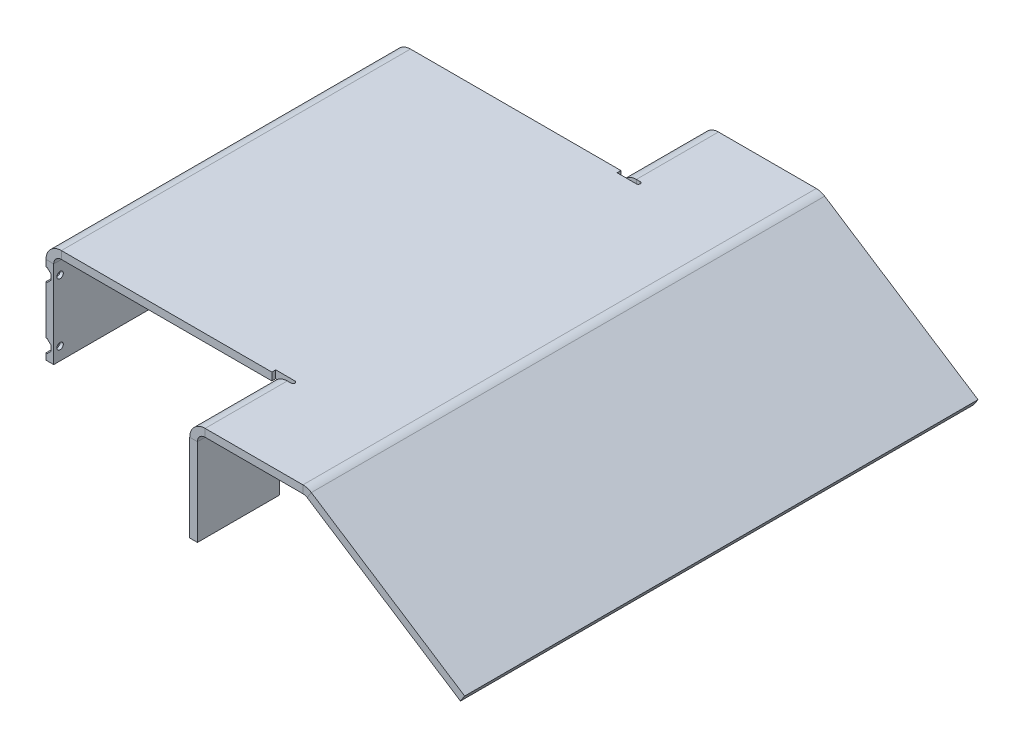
from build123d import *

# Parameters (mm, degrees)
SALIENTE_EXTRUIR1_DEPTH          = 3
BRIDA_DE_ARISTA1_STRIP_W         = 18
BRIDA_DE_ARISTA1_STRIP_H         = 3
BRIDA_DE_ARISTA1_STRIP_CUT_DEPTH = 136
BRIDA_DE_ARISTA1_DEPTH           = 136
CROQUIS5_R                       = 1.25
CORTAR_EXTRUIR1_DEPTH            = 3
CORTAR_EXTRUIR2_DEPTH            = 2
CHAFL_N1_SIZE                    = 1.5
BRIDA_START                      = -100
BRIDA_DE_ARISTA2_DEPTH           = 33.5
BRIDA_START_2                    = 66.5
BRIDA_DE_ARISTA2_2_DEPTH         = 33.5
BRIDA_DE_ARISTA2_3_DEPTH         = 32
BRIDA_START_3                    = 68
BRIDA_DE_ARISTA2_4_DEPTH         = 32
BRIDA_START_4                    = -3
BRIDA_DE_ARISTA2_5_DEPTH         = 7
BRIDA_DE_ARISTA3_STRIP_CUT_DEPTH = 200
BRIDA_DE_ARISTA3_DEPTH           = 200


with BuildPart() as part:
    # Croquis1 → Saliente-Extruir1 (new body)
    with BuildSketch(Plane(origin=(0, 0, 0), x_dir=(1, 0, 0), z_dir=(0, 1, 0))):
        Polygon((-42.5, -68), (42.5, -68), (42.5, -100), (87.5, -100), (87.5, 100), (42.5, 100), (42.5, 68), (-42.5, 68), align=None)
    extrude(amount=SALIENTE_EXTRUIR1_DEPTH)

    # Brida de arista1: sheet metal written as solids
    # Brida de arista1 strip (on a plane across the edge) → Brida de arista1 strip cut (cut)
    with BuildSketch(Plane(origin=(-42.5, 0, 68), x_dir=(1, 0, 0), z_dir=(0, 0, -1))):
        with Locations((-6, -1.5)):
            Rectangle(BRIDA_DE_ARISTA1_STRIP_W, BRIDA_DE_ARISTA1_STRIP_H)
    extrude(amount=BRIDA_DE_ARISTA1_STRIP_CUT_DEPTH, mode=Mode.SUBTRACT)

    # Brida de arista1 section (on a plane across the edge) → Brida de arista1 (add)
    with BuildSketch(Plane(origin=(-42.5, 0, 68), x_dir=(1, 0, 0), z_dir=(0, 0, -1))):
        with BuildLine():
            Line((-3, 3), (-3, 37))
            Line((-3, 37), (0, 37))
            Line((0, 37), (0, 3))
            ThreePointArc((0, 3), (0.878679656, 0.878679656), (3, 0))
            Line((3, 0), (3, -3))
            ThreePointArc((3, -3), (-1.242640687, -1.242640687), (-3, 3))
        make_face()
    extrude(amount=BRIDA_DE_ARISTA1_DEPTH)

    # Croquis5 → Cortar-Extruir1 (cut)
    with BuildSketch(Plane.ZY.offset(45.5)):
        with Locations(Location((65.5, -32, 0), (0, 0, 270))):
            Circle(CROQUIS5_R)
        with Locations(Location((65.5, -8, 0), (0, 0, 270))):
            Circle(CROQUIS5_R)
        with Locations(Location((-65.5, -8, 0), (0, 0, 90))):
            Circle(CROQUIS5_R)
        with Locations(Location((-65.5, -32, 0), (0, 0, 90))):
            Circle(CROQUIS5_R)
    extrude(amount=-CORTAR_EXTRUIR1_DEPTH, mode=Mode.SUBTRACT)

    # Croquis6 → Cortar-Extruir2 (cut)
    with BuildSketch(Plane.ZY.offset(45.5)):
        with BuildLine():
            Line((65.5, -5.5), (68, -5.5))
            Line((68, -5.5), (68, -10.5))
            Line((68, -10.5), (65.5, -10.5))
            ThreePointArc((65.5, -10.5), (63, -8), (65.5, -5.5))
        make_face()
        with BuildLine():
            Line((68, -29.5), (65.5, -29.5))
            ThreePointArc((65.5, -29.5), (63, -32), (65.5, -34.5))
            Line((65.5, -34.5), (68, -34.5))
            Line((68, -34.5), (68, -29.5))
        make_face()
        with BuildLine():
            Line((-65.5, -34.5), (-68, -34.5))
            Line((-68, -34.5), (-68, -29.5))
            Line((-68, -29.5), (-65.5, -29.5))
            ThreePointArc((-65.5, -29.5), (-63, -32), (-65.5, -34.5))
        make_face()
        with BuildLine():
            Line((-68, -10.5), (-65.5, -10.5))
            ThreePointArc((-65.5, -10.5), (-63, -8), (-65.5, -5.5))
            Line((-65.5, -5.5), (-68, -5.5))
            Line((-68, -5.5), (-68, -10.5))
        make_face()
    extrude(amount=-CORTAR_EXTRUIR2_DEPTH, mode=Mode.SUBTRACT)

    # Chaflán1
    # the kernel refuses this chamfer: 1.5 mm, written as the material it adds along each edge
    with BuildSketch(Plane(origin=(-43.5, -5.5, 65.5), x_dir=(-1, 0, 0), z_dir=(0, 0, 1))) as chafl_n1_piece_1_section:
        Polygon((CHAFL_N1_SIZE, 0), (0, CHAFL_N1_SIZE), (0, 0), align=None)
    chafl_n1_piece_1 = extrude(amount=2.5, mode=Mode.PRIVATE)
    chafl_n1_piece_1 = chafl_n1_piece_1 - Plane(origin=(-43.5, -8, 65.5), x_dir=(0, -1, 0), z_dir=(-1, 0, 0)) * Cylinder(1.25, 12, mode=Mode.PRIVATE)
    add(chafl_n1_piece_1)
    with BuildSketch(Plane(origin=(-43.5, -10.5, 68), x_dir=(0, 1, 0), z_dir=(0, 0, -1))) as chafl_n1_piece_2_section:
        Polygon((CHAFL_N1_SIZE, 0), (0, -CHAFL_N1_SIZE), (0, 0), align=None)
    chafl_n1_piece_2 = extrude(amount=2.5, mode=Mode.PRIVATE)
    chafl_n1_piece_2 = chafl_n1_piece_2 - Plane(origin=(-43.5, -8, 65.5), x_dir=(0, -1, 0), z_dir=(-1, 0, 0)) * Cylinder(1.25, 12, mode=Mode.PRIVATE)
    add(chafl_n1_piece_2)
    with BuildSketch(Plane(origin=(-43.5, -29.5, 68), x_dir=(-1, 0, 0), z_dir=(0, 0, -1))) as chafl_n1_piece_3_section:
        Polygon((CHAFL_N1_SIZE, 0), (0, -CHAFL_N1_SIZE), (0, 0), align=None)
    chafl_n1_piece_3 = extrude(amount=2.5, mode=Mode.PRIVATE)
    chafl_n1_piece_3 = chafl_n1_piece_3 - Plane(origin=(-43.5, -32, 65.5), x_dir=(0, -1, 0), z_dir=(-1, 0, 0)) * Cylinder(1.25, 12, mode=Mode.PRIVATE)
    add(chafl_n1_piece_3)
    with BuildSketch(Plane(origin=(-43.5, -34.5, 65.5), x_dir=(0, 1, 0), z_dir=(0, 0, 1))) as chafl_n1_piece_4_section:
        Polygon((CHAFL_N1_SIZE, 0), (0, CHAFL_N1_SIZE), (0, 0), align=None)
    chafl_n1_piece_4 = extrude(amount=2.5, mode=Mode.PRIVATE)
    chafl_n1_piece_4 = chafl_n1_piece_4 - Plane(origin=(-43.5, -32, 65.5), x_dir=(0, -1, 0), z_dir=(-1, 0, 0)) * Cylinder(1.25, 12, mode=Mode.PRIVATE)
    add(chafl_n1_piece_4)
    with BuildSketch(Plane(origin=(-43.5, -34.5, -65.5), x_dir=(-1, 0, 0), z_dir=(0, 0, -1))) as chafl_n1_piece_5_section:
        Polygon((CHAFL_N1_SIZE, 0), (0, CHAFL_N1_SIZE), (0, 0), align=None)
    chafl_n1_piece_5 = extrude(amount=2.5, mode=Mode.PRIVATE)
    chafl_n1_piece_5 = chafl_n1_piece_5 - Plane(origin=(-43.5, -32, -65.5), x_dir=(0, 1, 0), z_dir=(-1, 0, 0)) * Cylinder(1.25, 12, mode=Mode.PRIVATE)
    add(chafl_n1_piece_5)
    with BuildSketch(Plane(origin=(-43.5, -29.5, -68), x_dir=(-1, 0, 0), z_dir=(0, 0, 1))) as chafl_n1_piece_6_section:
        Polygon((CHAFL_N1_SIZE, 0), (0, CHAFL_N1_SIZE), (0, 0), align=None)
    chafl_n1_piece_6 = extrude(amount=2.5, mode=Mode.PRIVATE)
    chafl_n1_piece_6 = chafl_n1_piece_6 - Plane(origin=(-43.5, -32, -65.5), x_dir=(0, 1, 0), z_dir=(-1, 0, 0)) * Cylinder(1.25, 12, mode=Mode.PRIVATE)
    add(chafl_n1_piece_6)
    with BuildSketch(Plane(origin=(-43.5, -10.5, -68), x_dir=(-1, 0, 0), z_dir=(0, 0, 1))) as chafl_n1_piece_7_section:
        Polygon((CHAFL_N1_SIZE, 0), (0, -CHAFL_N1_SIZE), (0, 0), align=None)
    chafl_n1_piece_7 = extrude(amount=2.5, mode=Mode.PRIVATE)
    chafl_n1_piece_7 = chafl_n1_piece_7 - Plane(origin=(-43.5, -8, -65.5), x_dir=(0, 1, 0), z_dir=(-1, 0, 0)) * Cylinder(1.25, 12, mode=Mode.PRIVATE)
    add(chafl_n1_piece_7)
    with BuildSketch(Plane(origin=(-43.5, -5.5, -65.5), x_dir=(-1, 0, 0), z_dir=(0, 0, -1))) as chafl_n1_piece_8_section:
        Polygon((CHAFL_N1_SIZE, 0), (0, -CHAFL_N1_SIZE), (0, 0), align=None)
    chafl_n1_piece_8 = extrude(amount=2.5, mode=Mode.PRIVATE)
    chafl_n1_piece_8 = chafl_n1_piece_8 - Plane(origin=(-43.5, -8, -65.5), x_dir=(0, 1, 0), z_dir=(-1, 0, 0)) * Cylinder(1.25, 12, mode=Mode.PRIVATE)
    add(chafl_n1_piece_8)
    with BuildSketch(Plane(origin=(-43.5, -8, -65.5), x_dir=(0, -1, 0), z_dir=(0, 0, -1))) as chafl_n1_piece_9_section:
        Polygon((2.5, CHAFL_N1_SIZE), (2.5 - CHAFL_N1_SIZE, 0), (2.5, 0), align=None)
    chafl_n1_piece_9 = revolve(axis=Axis((-43.5, -8, -65.5), (-1, 0, 0)), revolution_arc=180, mode=Mode.PRIVATE)
    chafl_n1_piece_9 = chafl_n1_piece_9 - Plane(origin=(-43.5, -8, -65.5), x_dir=(0, 1, 0), z_dir=(-1, 0, 0)) * Cylinder(1.25, 11, mode=Mode.PRIVATE)
    add(chafl_n1_piece_9)
    with BuildSketch(Plane(origin=(-43.5, -32, -65.5), x_dir=(0, 1, 0), z_dir=(0, 0, -1))) as chafl_n1_piece_10_section:
        Polygon((2.5, -CHAFL_N1_SIZE), (2.5 - CHAFL_N1_SIZE, 0), (2.5, 0), align=None)
    chafl_n1_piece_10 = revolve(axis=Axis((-43.5, -32, -65.5), (1, 0, 0)), revolution_arc=180, mode=Mode.PRIVATE)
    chafl_n1_piece_10 = chafl_n1_piece_10 - Plane(origin=(-43.5, -32, -65.5), x_dir=(0, 1, 0), z_dir=(-1, 0, 0)) * Cylinder(1.25, 11, mode=Mode.PRIVATE)
    add(chafl_n1_piece_10)
    with BuildSketch(Plane(origin=(-43.5, -32, 65.5), x_dir=(0, 1, 0), z_dir=(0, 0, 1))) as chafl_n1_piece_11_section:
        Polygon((2.5 - CHAFL_N1_SIZE, 0), (2.5, CHAFL_N1_SIZE), (2.5, 0), align=None)
    chafl_n1_piece_11 = revolve(axis=Axis((-43.5, -32, 65.5), (-1, 0, 0)), revolution_arc=180, mode=Mode.PRIVATE)
    chafl_n1_piece_11 = chafl_n1_piece_11 - Plane(origin=(-43.5, -32, 65.5), x_dir=(0, -1, 0), z_dir=(-1, 0, 0)) * Cylinder(1.25, 11, mode=Mode.PRIVATE)
    add(chafl_n1_piece_11)
    with BuildSketch(Plane(origin=(-43.5, -8, 65.5), x_dir=(0, -1, 0), z_dir=(0, 0, 1))) as chafl_n1_piece_12_section:
        Polygon((2.5 - CHAFL_N1_SIZE, 0), (2.5, -CHAFL_N1_SIZE), (2.5, 0), align=None)
    chafl_n1_piece_12 = revolve(axis=Axis((-43.5, -8, 65.5), (1, 0, 0)), revolution_arc=180, mode=Mode.PRIVATE)
    chafl_n1_piece_12 = chafl_n1_piece_12 - Plane(origin=(-43.5, -8, 65.5), x_dir=(0, -1, 0), z_dir=(-1, 0, 0)) * Cylinder(1.25, 11, mode=Mode.PRIVATE)
    add(chafl_n1_piece_12)

    # Brida de arista2: read off the stored shape, not the designer's step
    # Brida de arista2 outline → Brida de arista2 (cut)
    with BuildSketch(Plane.XY.offset(BRIDA_START)):
        with BuildLine():
            Line((42.5, 0), (43.303847577, 0))
            ThreePointArc((43.303847577, 0), (45.5, 2.196152423), (48.5, 3))
            Line((48.5, 3), (42.5, 3))
            Line((42.5, 3), (42.5, 0))
        make_face()
    extrude(amount=BRIDA_DE_ARISTA2_DEPTH, mode=Mode.SUBTRACT)

    # Brida de arista2 2 outline → Brida de arista2 2 (cut)
    with BuildSketch(Plane.XY.offset(BRIDA_START_2)):
        with BuildLine():
            Line((42.5, 0), (43.303847577, 0))
            ThreePointArc((43.303847577, 0), (45.5, 2.196152423), (48.5, 3))
            Line((48.5, 3), (42.5, 3))
            Line((42.5, 3), (42.5, 0))
        make_face()
    extrude(amount=BRIDA_DE_ARISTA2_2_DEPTH, mode=Mode.SUBTRACT)

    # Brida de arista2 3 outline → Brida de arista2 3 (add)
    with BuildSketch(Plane.XY.offset(BRIDA_START)):
        with BuildLine():
            Line((42.5, -37), (45.5, -37))
            Line((45.5, -37), (45.5, -3))
            ThreePointArc((45.5, -3), (46.378679656, -0.878679656), (48.5, 0))
            Line((48.5, 0), (43.303847577, 0))
            ThreePointArc((43.303847577, 0), (42.704445042, -1.447085729), (42.5, -3))
            Line((42.5, -3), (42.5, -37))
        make_face()
    extrude(amount=BRIDA_DE_ARISTA2_3_DEPTH)

    # Brida de arista2 4 outline → Brida de arista2 4 (add)
    with BuildSketch(Plane.XY.offset(BRIDA_START_3)):
        with BuildLine():
            Line((42.5, -37), (45.5, -37))
            Line((45.5, -37), (45.5, -3))
            ThreePointArc((45.5, -3), (46.378679656, -0.878679656), (48.5, 0))
            Line((48.5, 0), (43.303847577, 0))
            ThreePointArc((43.303847577, 0), (42.704445042, -1.447085729), (42.5, -3))
            Line((42.5, -3), (42.5, -37))
        make_face()
    extrude(amount=BRIDA_DE_ARISTA2_4_DEPTH)

    # Brida de arista2 5 outline → Brida de arista2 5 (cut)
    with BuildSketch(Plane(origin=(0, 0, 0), x_dir=(1, 0, 0), z_dir=(0, 1, 0)).offset(BRIDA_START_4)):
        with BuildLine():
            Line((50, -66.5), (43, -66.5))
            Line((43, -66.5), (43, -68))
            Line((43, -68), (50, -68))
            ThreePointArc((50, -68), (50.75, -67.25), (50, -66.5))
        make_face()
        with BuildLine():
            Line((43, 68), (43, 66.5))
            Line((43, 66.5), (50, 66.5))
            ThreePointArc((50, 66.5), (50.75, 67.25), (50, 68))
            Line((50, 68), (43, 68))
        make_face()
    extrude(amount=BRIDA_DE_ARISTA2_5_DEPTH, mode=Mode.SUBTRACT)

    # Brida de arista3: sheet metal written as solids
    # Brida de arista3 strip (on a plane across the edge) → Brida de arista3 strip cut (cut)
    with BuildSketch(Plane(origin=(87.5, 0, -100), x_dir=(-0.5446390350150233, -0.8386705679454266, 0), z_dir=(0, 0, 1))):
        Polygon((-11.835526038, 12.716876498), (-2.032023408, -2.379193725), (0.483988296, -0.74527662), (-9.319514334, 14.350793603), align=None)
    extrude(amount=BRIDA_DE_ARISTA3_STRIP_CUT_DEPTH, mode=Mode.SUBTRACT)

    # Brida de arista3 section (on a plane across the edge) → Brida de arista3 (add)
    with BuildSketch(Plane(origin=(87.5, 0, -100), x_dir=(-0.5446390350150233, -0.8386705679454266, 0), z_dir=(0, 0, 1))):
        with BuildLine():
            Line((-3, 0.888640485), (-3, 72.111359515))
            Line((-3, 72.111359515), (0, 72.111359515))
            Line((0, 72.111359515), (0, 0.888640485))
            ThreePointArc((0, 0.888640485), (0.123540795, 0.036594451), (0.483988296, -0.74527662))
            Line((0.483988296, -0.74527662), (-2.032023408, -2.379193725))
            ThreePointArc((-2.032023408, -2.379193725), (-2.752918409, -0.815451583), (-3, 0.888640485))
        make_face()
    extrude(amount=BRIDA_DE_ARISTA3_DEPTH)


solid = part.part
